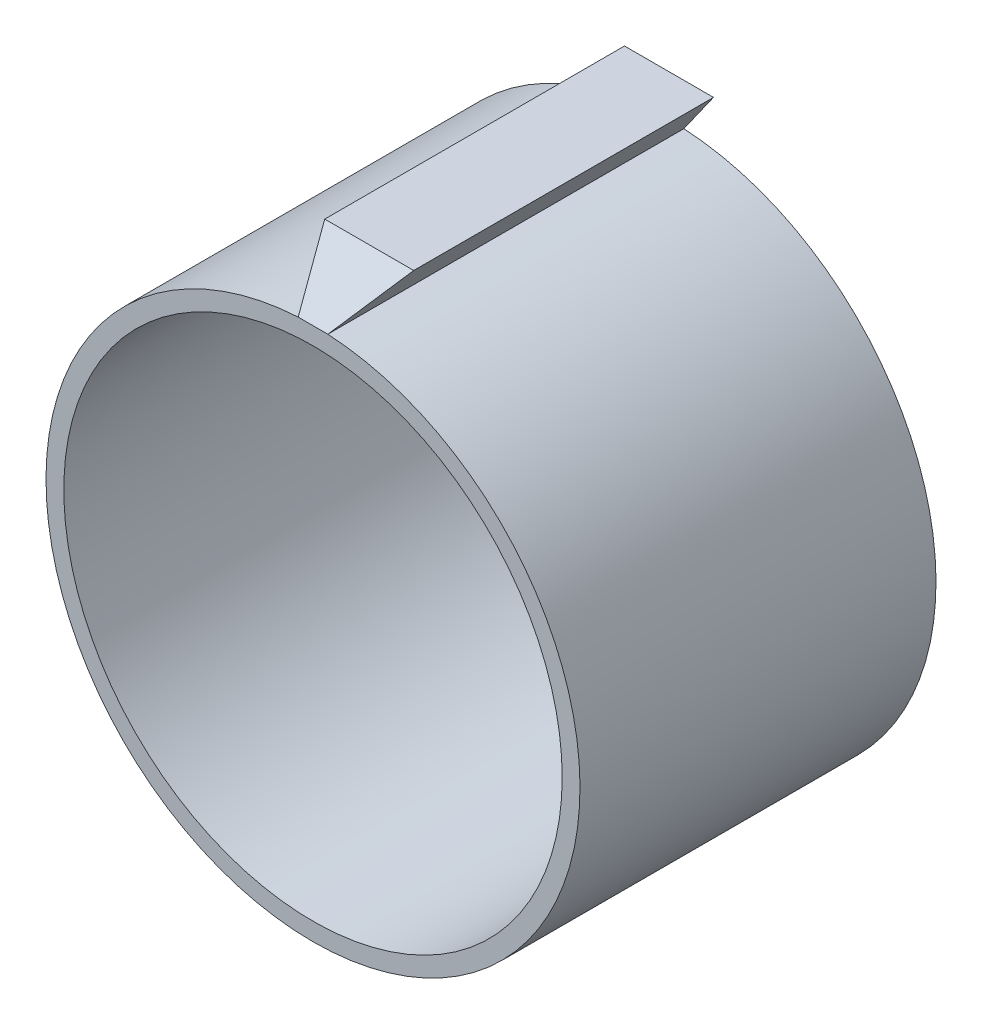
from build123d import *

# Parameters (mm, degrees)
BOSS_EXTRUDE1_DEPTH            = 60
CUT_EXTRUDE1_REACH             = 93.263
CUT_EXTRUDE1_DIRECTION_2_REACH = 93.263


with BuildPart() as part:
    # Sketch1 → Boss-Extrude1 (new body)
    with BuildSketch(Plane.XY):
        with BuildLine():
            Line((7.5, 52), (-7.5, 52))
            Line((-7.5, 52), (-2.5, 44.930501889))
            ThreePointArc((-2.5, 44.930501889), (-12.910485027, -43.108228639), (26.785714286, 36.159722209))
            ThreePointArc((26.785714286, 36.159722209), (15.285447634, 42.324403016), (2.5, 44.930501889))
            Line((2.5, 44.930501889), (7.5, 52))
        make_face()
        with BuildLine():
            ThreePointArc((25, 33.749074061), (37.509998667, 18.894443628), (42, 0))
            ThreePointArc((42, 0), (-18.894443628, -37.509998667), (-25, 33.749074061))
            ThreePointArc((-25, 33.749074061), (0, 42), (25, 33.749074061))
        make_face(mode=Mode.SUBTRACT)
    extrude(amount=BOSS_EXTRUDE1_DEPTH)

    # Cut-Extrude1: up to this plane
    cut_extrude1_end = Plane(origin=(-19.51558879, 13.802669216, 60), z_dir=(0.8164361496977239, -0.577435722368088, 0))
    # Sketch2 → Cut-Extrude1 (cut, up to the surface)
    with BuildSketch(Plane(origin=(0, 0, 0), x_dir=(0, 0, -1), z_dir=(1, 0, 0)), mode=Mode.PRIVATE) as cut_extrude1_sk1:
        Polygon((-60, 44.930501889), (-50.525141204, 52), (-60, 52), align=None)
    cut_extrude1_tool1 = split(extrude(cut_extrude1_sk1.sketch, amount=CUT_EXTRUDE1_REACH, mode=Mode.PRIVATE), bisect_by=cut_extrude1_end, keep=Keep.BOTH, mode=Mode.PRIVATE)
    add(cut_extrude1_tool1.solids().sort_by_distance((0, 49.643501, 56.841714))[0], mode=Mode.SUBTRACT)

    # Cut-Extrude1 direction 2: up to this plane
    cut_extrude1_direction_2_end = Plane(origin=(19.51558879, 13.802669216, 60), z_dir=(0.8164361496977239, 0.577435722368088, 0))
    # Sketch2 → Cut-Extrude1 direction 2 (cut, up to the surface)
    with BuildSketch(Plane(origin=(0, 0, 0), x_dir=(0, 0, -1), z_dir=(1, 0, 0)), mode=Mode.PRIVATE) as cut_extrude1_direction_2_sk1:
        Polygon((-60, 44.930501889), (-50.525141204, 52), (-60, 52), align=None)
    cut_extrude1_direction_2_tool1 = split(extrude(cut_extrude1_direction_2_sk1.sketch, amount=-CUT_EXTRUDE1_DIRECTION_2_REACH, mode=Mode.PRIVATE), bisect_by=cut_extrude1_direction_2_end, keep=Keep.BOTH, mode=Mode.PRIVATE)
    add(cut_extrude1_direction_2_tool1.solids().sort_by_distance((0, 49.643501, 56.841714))[0], mode=Mode.SUBTRACT)


solid = part.part
